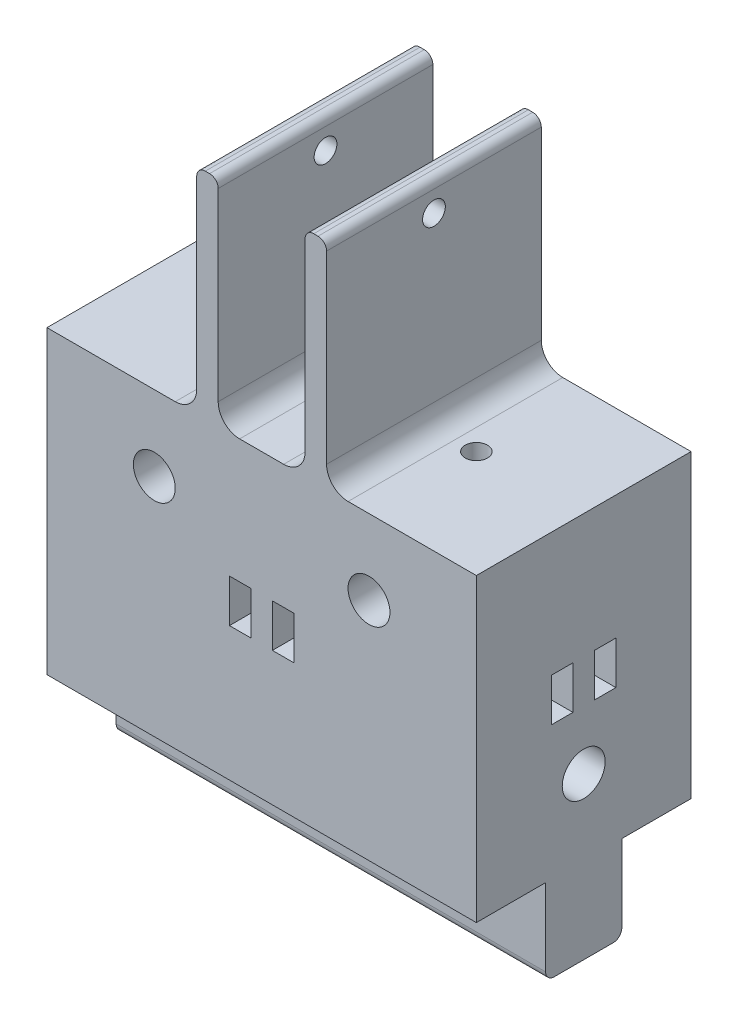
from build123d import *

# Parameters (mm, degrees)
SKETCH1_W               = 100
SKETCH1_H               = 70
BOSS_EXTRUDE1_DEPTH     = 25
CUT_EXTRUDE1_DEPTH      = 79.89866919
CUT_EXTRUDE1_DEPTH_BACK = 79.89866919
SKETCH2_R               = 4.875
CUT_EXTRUDE2_DEPTH      = 109.857705285
CUT_EXTRUDE2_DEPTH_BACK = 109.857705285
SKETCH3_R               = 5
SKETCH4_R               = 2.6
CUT_EXTRUDE4_DEPTH      = 20
SKETCH5_W               = 100
SKETCH5_H               = 17.75
BOSS_EXTRUDE2_DEPTH     = 20
FILLET1_R               = 2
SKETCH6_W               = 5
SKETCH6_H               = 50
BOSS_EXTRUDE3_DEPTH     = 50
CUT_EXTRUDE5_DEPTH      = 110.960291151
CUT_EXTRUDE5_DEPTH_BACK = 110.960291151
SKETCH7_R               = 2.65
FILLET2_R               = 5
FILLET3_R               = 2
CUT_EXTRUDE6_DEPTH      = 134.603892178
CUT_EXTRUDE6_DEPTH_BACK = 134.603892178
SKETCH8_W               = 5
SKETCH8_H               = 10
CUT_EXTRUDE7_DEPTH      = 111.566721983
CUT_EXTRUDE7_DEPTH_BACK = 111.566721983
SKETCH9_W               = 5
SKETCH9_H               = 10
FILLET4_R               = 10


with BuildPart() as part:
    # Sketch1 → Boss-Extrude1 (new, symmetric)
    with BuildSketch(Plane.XY):
        Rectangle(SKETCH1_W, SKETCH1_H)
    extrude(amount=BOSS_EXTRUDE1_DEPTH, both=True)

    # Sketch2 → Cut-Extrude1 (cut, two sides: drawn at the far end of the back side and taken through both)
    with BuildSketch(Plane.XY.offset(25).offset(-CUT_EXTRUDE1_DEPTH_BACK)):
        with Locations((25, 17.5)):
            Circle(SKETCH2_R)
        with Locations((-25, 17.5)):
            Circle(SKETCH2_R)
    extrude(amount=CUT_EXTRUDE1_DEPTH + CUT_EXTRUDE1_DEPTH_BACK, mode=Mode.SUBTRACT)

    # Sketch3 → Cut-Extrude2 (cut, two sides: drawn at the far end of the back side and taken through both)
    with BuildSketch(Plane.ZY.offset(50).offset(-CUT_EXTRUDE2_DEPTH_BACK)):
        with Locations((0, -17.5)):
            Circle(SKETCH3_R)
    extrude(amount=CUT_EXTRUDE2_DEPTH + CUT_EXTRUDE2_DEPTH_BACK, mode=Mode.SUBTRACT)

    # Sketch4 → Cut-Extrude4 (cut)
    with BuildSketch(Plane(origin=(0, 35, 0), x_dir=(1, 0, 0), z_dir=(0, 1, 0))):
        with Locations((-25, 0)):
            Circle(SKETCH4_R)
        with Locations((25, 0)):
            Circle(SKETCH4_R)
    extrude(amount=-CUT_EXTRUDE4_DEPTH, mode=Mode.SUBTRACT)

    # Sketch5 → Boss-Extrude2 (add)
    with BuildSketch(Plane.XZ.offset(35)):
        Rectangle(SKETCH5_W, SKETCH5_H)
    extrude(amount=BOSS_EXTRUDE2_DEPTH)

    # Fillet1
    fillet1_edges = [part.edges().sort_by_distance(p)[0] for p in [
        (0, -55, -8.875),
        (0, -55, 8.875),
    ]]
    fillet(fillet1_edges, radius=FILLET1_R)

    # Sketch6 → Boss-Extrude3 (add)
    with BuildSketch(Plane(origin=(0, 35, 0), x_dir=(1, 0, 0), z_dir=(0, 1, 0))):
        with Locations((-12.625, 0)):
            Rectangle(SKETCH6_W, SKETCH6_H)
        with Locations((12.625, 0)):
            Rectangle(SKETCH6_W, SKETCH6_H)
    extrude(amount=BOSS_EXTRUDE3_DEPTH)

    # Sketch7 → Cut-Extrude5 (cut, two sides: drawn at the far end of the back side and taken through both)
    with BuildSketch(Plane(origin=(15.125, 0, 0), x_dir=(0, 0, -1), z_dir=(1, 0, 0)).offset(-CUT_EXTRUDE5_DEPTH_BACK)):
        with Locations((0, 78.15)):
            Circle(SKETCH7_R)
    extrude(amount=CUT_EXTRUDE5_DEPTH + CUT_EXTRUDE5_DEPTH_BACK, mode=Mode.SUBTRACT)

    # Fillet2
    fillet2_edges = [part.edges().sort_by_distance(p)[0] for p in [
        (-15.125, 35, 0),
        (-10.125, 35, 0),
        (10.125, 35, 0),
        (15.125, 35, 0),
    ]]
    fillet(fillet2_edges, radius=FILLET2_R)

    # Fillet3
    fillet3_edges = [part.edges().sort_by_distance(p)[0] for p in [
        (15.125, 85, 0),
        (10.125, 85, 0),
        (-10.125, 85, 0),
        (-15.125, 85, 0),
    ]]
    fillet(fillet3_edges, radius=FILLET3_R)

    # Sketch8 → Cut-Extrude6 (cut, two sides: drawn at the far end of the back side and taken through both)
    with BuildSketch(Plane.ZY.offset(50).offset(-CUT_EXTRUDE6_DEPTH_BACK)):
        with Locations((-5, 1.15)):
            Rectangle(SKETCH8_W, SKETCH8_H)
        with Locations((5, 1.15)):
            Rectangle(SKETCH8_W, SKETCH8_H)
    extrude(amount=CUT_EXTRUDE6_DEPTH + CUT_EXTRUDE6_DEPTH_BACK, mode=Mode.SUBTRACT)

    # Sketch9 → Cut-Extrude7 (cut, two sides: drawn at the far end of the back side and taken through both)
    with BuildSketch(Plane.XY.offset(25).offset(-CUT_EXTRUDE7_DEPTH_BACK)):
        with Locations((-5, 1.15)):
            Rectangle(SKETCH9_W, SKETCH9_H)
        with Locations((5, 1.15)):
            Rectangle(SKETCH9_W, SKETCH9_H)
    extrude(amount=CUT_EXTRUDE7_DEPTH + CUT_EXTRUDE7_DEPTH_BACK, mode=Mode.SUBTRACT)

    # Fillet4
    fillet4_edges = [part.edges().sort_by_distance(p)[0] for p in [
        (7.5, 1.15, 7.5),
        (7.5, 1.15, -7.5),
        (-7.5, 1.15, -7.5),
        (-7.5, 1.15, 7.5),
    ]]
    fillet(fillet4_edges, radius=FILLET4_R)


solid = part.part
